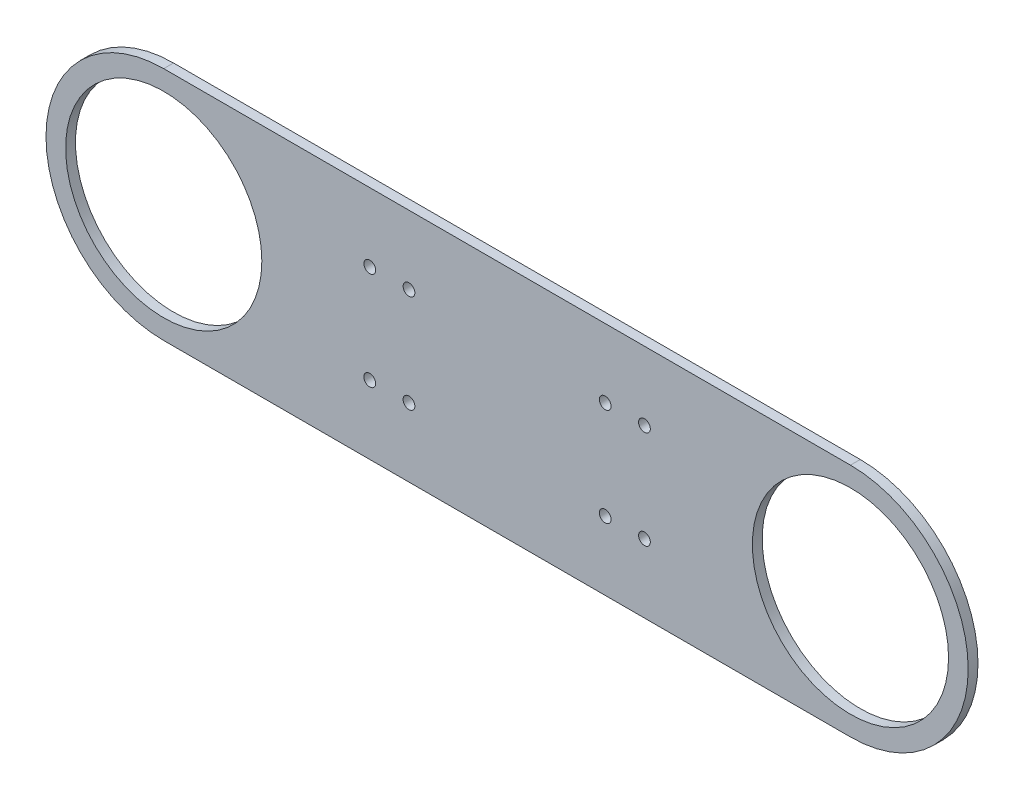
from build123d import *

# Parameters (mm, degrees)
SKETCH_2_R               = 50
SM_BASE_FLANGE_1_DEPTH   = 5
SKETCH_3_R               = 3
CUT_EXTRUDE_1_DEPTH      = 10
MIRROR_2_COPY_1_SKETCH_R = 3
MIRROR_2_COPY_1_DEPTH    = 10


# Sheet-metal steps are written as plain solids
with BuildPart() as part:
    # Sketch 2 → 基体-法兰1 (new body)
    with BuildSketch(Plane.XY):
        with BuildLine():
            Line((0, 60), (350, 60))
            ThreePointArc((350, 60), (410, 0), (350, -60))
            Line((350, -60), (0, -60))
            ThreePointArc((0, -60), (-60, 0), (0, 60))
        make_face()
        Circle(SKETCH_2_R, mode=Mode.SUBTRACT)
        with Locations((350, 0)):
            Circle(SKETCH_2_R, mode=Mode.SUBTRACT)
    extrude(amount=-SM_BASE_FLANGE_1_DEPTH)

    # 草图3 → 切除-拉伸1 (cut)
    with BuildSketch(Plane.XY):
        with Locations((225, 25)):
            Circle(SKETCH_3_R)
        with Locations((245, 25)):
            Circle(SKETCH_3_R)
    cut_extrude_1 = extrude(amount=-CUT_EXTRUDE_1_DEPTH, mode=Mode.SUBTRACT)

    # 镜向1: 切除-拉伸1 across plane
    add(cut_extrude_1.mirror(Plane.ZX), mode=Mode.SUBTRACT)

    # 镜向2: 切除-拉伸1 across plane
    add(cut_extrude_1.mirror(Plane(origin=(175, 0, 0), x_dir=(0, 0, 1), z_dir=(1, 0, 0))), mode=Mode.SUBTRACT)

    # 镜向2 copy 1 sketch → 镜向2 copy 1 (cut)
    with BuildSketch(Plane(origin=(350, 0, 0), x_dir=(-1, 0, 0), z_dir=(0, 0, 1))):
        with Locations((225, 25)):
            Circle(MIRROR_2_COPY_1_SKETCH_R)
        with Locations((245, 25)):
            Circle(MIRROR_2_COPY_1_SKETCH_R)
    extrude(amount=-MIRROR_2_COPY_1_DEPTH, mode=Mode.SUBTRACT)


solid = part.part
